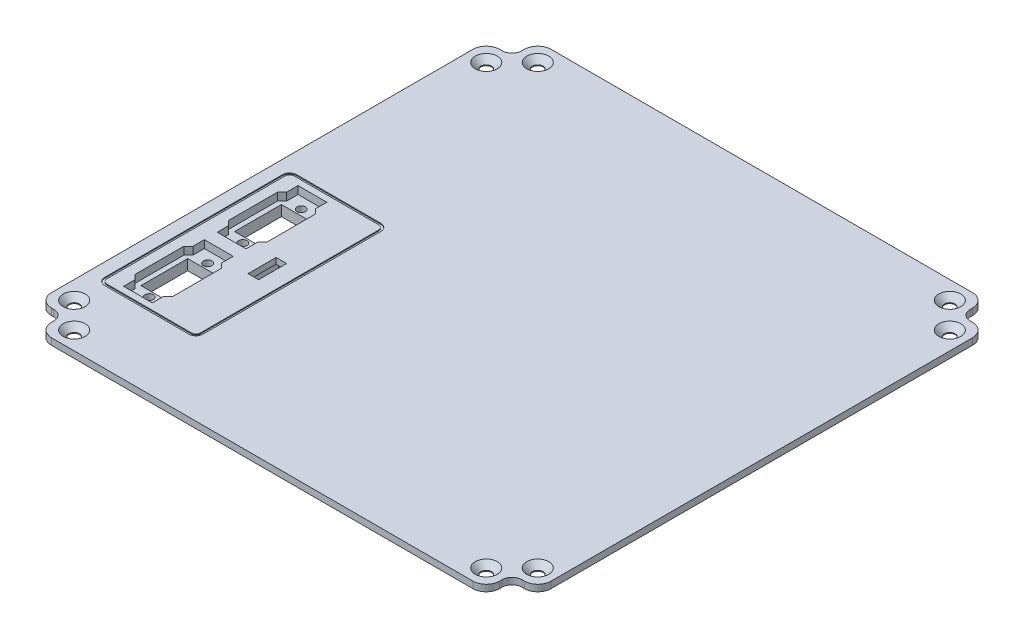
from build123d import *
from OCP.BRepFilletAPI import BRepFilletAPI_MakeChamfer, BRepFilletAPI_MakeFillet

# Parameters (mm, degrees)
SKETCH1_W                     = 214
SKETCH1_H                     = 214
BOSS_EXTRUDE1_DEPTH           = 2.8
SKETCH2_W                     = 11
SKETCH2_H                     = 11
CUT_EXTRUDE1_DEPTH            = 152.346754177
FILLET1_R1                    = 6
FILLET1_R2                    = 4
CIRPATTERN1_COUNT             = 4
FILLET1_OF_CIRPATTERN1_R1     = 6
FILLET1_OF_CIRPATTERN1_R2     = 4
FILLET1_OF_CIRPATTERN1_R3     = 6
FILLET1_OF_CIRPATTERN1_R4     = 4
FILLET1_OF_CIRPATTERN1_R5     = 6
FILLET1_OF_CIRPATTERN1_R6     = 4
CUT_EXTRUDE2_DEPTH            = 152.346754177
SKETCH7_R                     = 4.7
BOSS_EXTRUDE2_DEPTH           = 2.8
SKETCH8_W                     = 64.2
SKETCH8_H                     = 64.2
BOSS_EXTRUDE4_DEPTH           = 5
CHAMFER1_SIZE                 = 5
CHAMFER1_SIZE2                = 35
BOSS_EXTRUDE5_REACH           = 152.979
SKETCH10_W                    = 35
SKETCH10_H                    = 10.8
SKETCH10_H_2                  = 74.2
SKETCH10_H_3                  = 5
SKETCH9_W                     = 12
SKETCH9_H                     = 20
CUT_EXTRUDE3_DEPTH            = 3.3
SKETCH16_W                    = 12
SKETCH16_H                    = 20
CUT_EXTRUDE6_DEPTH            = 152.098047638
M3_CLEARANCE_HOLE1_AT_2_COUNT = 2
M3_CLEARANCE_HOLE1_AT_2_PITCH = 25
CUT_EXTRUDE_THIN1_DEPTH       = 0.4
LPATTERN1_COUNT               = 2
LPATTERN1_PITCH               = 40
SKETCH11_W                    = 4
SKETCH11_H                    = 143.4
SKETCH11_W_2                  = 143.4
SKETCH11_H_2                  = 4
SKETCH11_H_3                  = 10
CUT_EXTRUDE4_DEPTH            = 151.979402569
SKETCH12_W                    = 10.2
SKETCH12_H                    = 90
CUT_EXTRUDE5_DEPTH            = 151.979402569
SKETCH19_W                    = 8
SKETCH19_H                    = 64.2
BOSS_EXTRUDE6_DEPTH           = 5
SKETCH18_W                    = 4.5
SKETCH18_H                    = 12
CUT_EXTRUDE8_DEPTH            = 152.098047638
SKETCH21_W                    = 17.05
SKETCH21_H                    = 20
CUT_EXTRUDE10_DEPTH           = 5.3
SKETCH24_W                    = 17.05
SKETCH24_H                    = 20
SKETCH24_W_2                  = 7.3
SKETCH24_H_2                  = 16.9
BOSS_EXTRUDE7_DEPTH           = 7


# Read off the part's stored shape, not the designer's step: CSK for M4 Flat Head Machine Screw1
with BuildPart() as part:
    # Sketch1 → Boss-Extrude1 (new body)
    with BuildSketch(Plane(origin=(0, 0, 0), x_dir=(1, 0, 0), z_dir=(0, 1, 0))):
        Rectangle(SKETCH1_W, SKETCH1_H)
    extrude(amount=BOSS_EXTRUDE1_DEPTH)

    # Sketch2 → Cut-Extrude1 (cut, through all)
    with BuildSketch(Plane(origin=(0, 2.8, 0), x_dir=(1, 0, 0), z_dir=(0, 1, 0))):
        with Locations((-101.5, -101.5)):
            Rectangle(SKETCH2_W, SKETCH2_H)
    cut_extrude1 = extrude(amount=-CUT_EXTRUDE1_DEPTH, mode=Mode.SUBTRACT)

    # Fillet1: one fillet with a radius per group of edges: ONE call of the kernel's fillet builder (fillet() takes one radius for all edges)
    fillet1_edges_1 = [part.edges().sort_by_distance(p)[0] for p in [
        (-107, 1.4, 96),
        (-96, 1.4, 107),
    ]]
    fillet1_edges_2 = [part.edges().sort_by_distance(p)[0] for p in [
        (-96, 1.4, 96),
    ]]
    fillet1 = BRepFilletAPI_MakeFillet(part.part.solid().wrapped)
    for e in fillet1_edges_1:
        fillet1.Add(FILLET1_R1, e.wrapped)
    for e in fillet1_edges_2:
        fillet1.Add(FILLET1_R2, e.wrapped)
    add(Compound.cast(fillet1.Shape()), mode=Mode.REPLACE)

    # CirPattern1: Cut-Extrude1 ×4 about axis
    cirpattern1_axis = Axis((0, 0, 0), (0, 1, 0))
    for i in range(1, CIRPATTERN1_COUNT):
        add(cut_extrude1.rotate(cirpattern1_axis, i * 360 / CIRPATTERN1_COUNT), mode=Mode.SUBTRACT)

    # Fillet1 of CirPattern1: one fillet with a radius per group of edges: ONE call of the kernel's fillet builder (fillet() takes one radius for all edges)
    fillet1_of_cirpattern1_edges_1 = [part.edges().sort_by_distance(p)[0] for p in [
        (96, 1.4, 107),
        (107, 1.4, 96),
    ]]
    fillet1_of_cirpattern1_edges_2 = [part.edges().sort_by_distance(p)[0] for p in [
        (96, 1.4, 96),
    ]]
    fillet1_of_cirpattern1_edges_3 = [part.edges().sort_by_distance(p)[0] for p in [
        (107, 1.4, -96),
        (96, 1.4, -107),
    ]]
    fillet1_of_cirpattern1_edges_4 = [part.edges().sort_by_distance(p)[0] for p in [
        (96, 1.4, -96),
    ]]
    fillet1_of_cirpattern1_edges_5 = [part.edges().sort_by_distance(p)[0] for p in [
        (-96, 1.4, -107),
        (-107, 1.4, -96),
    ]]
    fillet1_of_cirpattern1_edges_6 = [part.edges().sort_by_distance(p)[0] for p in [
        (-96, 1.4, -96),
    ]]
    fillet1_of_cirpattern1 = BRepFilletAPI_MakeFillet(part.part.solid().wrapped)
    for e in fillet1_of_cirpattern1_edges_1:
        fillet1_of_cirpattern1.Add(FILLET1_OF_CIRPATTERN1_R1, e.wrapped)
    for e in fillet1_of_cirpattern1_edges_2:
        fillet1_of_cirpattern1.Add(FILLET1_OF_CIRPATTERN1_R2, e.wrapped)
    for e in fillet1_of_cirpattern1_edges_3:
        fillet1_of_cirpattern1.Add(FILLET1_OF_CIRPATTERN1_R3, e.wrapped)
    for e in fillet1_of_cirpattern1_edges_4:
        fillet1_of_cirpattern1.Add(FILLET1_OF_CIRPATTERN1_R4, e.wrapped)
    for e in fillet1_of_cirpattern1_edges_5:
        fillet1_of_cirpattern1.Add(FILLET1_OF_CIRPATTERN1_R5, e.wrapped)
    for e in fillet1_of_cirpattern1_edges_6:
        fillet1_of_cirpattern1.Add(FILLET1_OF_CIRPATTERN1_R6, e.wrapped)
    add(Compound.cast(fillet1_of_cirpattern1.Shape()), mode=Mode.REPLACE)

    # Sketch3 → Cut-Extrude2 (cut, through all)
    with BuildSketch(Plane(origin=(0, 2.8, 0), x_dir=(1, 0, 0), z_dir=(0, 1, 0))):
        with BuildLine():
            Line((100, -96), (101, -96))
            ThreePointArc((101, -96), (105.242640687, -94.242640687), (107, -90))
            Line((107, -90), (107, 90))
            ThreePointArc((107, 90), (105.242640687, 94.242640687), (101, 96))
            Line((101, 96), (100, 96))
            ThreePointArc((100, 96), (97.171572875, 97.171572875), (96, 100))
            Line((96, 100), (96, 101))
            ThreePointArc((96, 101), (94.242640687, 105.242640687), (90, 107))
            Line((90, 107), (-90, 107))
            ThreePointArc((-90, 107), (-94.242640687, 105.242640687), (-96, 101))
            Line((-96, 101), (-96, 100))
            ThreePointArc((-96, 100), (-97.171572875, 97.171572875), (-100, 96))
            Line((-100, 96), (-101, 96))
            ThreePointArc((-101, 96), (-105.242640687, 94.242640687), (-107, 90))
            Line((-107, 90), (-107, -90))
            ThreePointArc((-107, -90), (-105.242640687, -94.242640687), (-101, -96))
            Line((-101, -96), (-100, -96))
            ThreePointArc((-100, -96), (-97.171572875, -97.171572875), (-96, -100))
            Line((-96, -100), (-96, -101))
            ThreePointArc((-96, -101), (-94.242640687, -105.242640687), (-90, -107))
            Line((-90, -107), (90, -107))
            ThreePointArc((90, -107), (94.242640687, -105.242640687), (96, -101))
            Line((96, -101), (96, -100))
            ThreePointArc((96, -100), (97.171572875, -97.171572875), (100, -96))
        make_face()
        with BuildLine():
            Line((100, -95.7), (101, -95.7))
            ThreePointArc((101, -95.7), (105.030508653, -94.030508653), (106.7, -90))
            Line((106.7, -90), (106.7, 90))
            ThreePointArc((106.7, 90), (105.030508653, 94.030508653), (101, 95.7))
            Line((101, 95.7), (100, 95.7))
            ThreePointArc((100, 95.7), (96.959440841, 96.959440841), (95.7, 100))
            Line((95.7, 100), (95.7, 101))
            ThreePointArc((95.7, 101), (94.030508653, 105.030508653), (90, 106.7))
            Line((90, 106.7), (-90, 106.7))
            ThreePointArc((-90, 106.7), (-94.030508653, 105.030508653), (-95.7, 101))
            Line((-95.7, 101), (-95.7, 100))
            ThreePointArc((-95.7, 100), (-96.959440841, 96.959440841), (-100, 95.7))
            Line((-100, 95.7), (-101, 95.7))
            ThreePointArc((-101, 95.7), (-105.030508653, 94.030508653), (-106.7, 90))
            Line((-106.7, 90), (-106.7, -90))
            ThreePointArc((-106.7, -90), (-105.030508653, -94.030508653), (-101, -95.7))
            Line((-101, -95.7), (-100, -95.7))
            ThreePointArc((-100, -95.7), (-96.959440841, -96.959440841), (-95.7, -100))
            Line((-95.7, -100), (-95.7, -101))
            ThreePointArc((-95.7, -101), (-94.030508653, -105.030508653), (-90, -106.7))
            Line((-90, -106.7), (90, -106.7))
            ThreePointArc((90, -106.7), (94.030508653, -105.030508653), (95.7, -101))
            Line((95.7, -101), (95.7, -100))
            ThreePointArc((95.7, -100), (96.959440841, -96.959440841), (100, -95.7))
        make_face(mode=Mode.SUBTRACT)
    extrude(amount=-CUT_EXTRUDE2_DEPTH, mode=Mode.SUBTRACT)

    # CSK for M4 Flat Head Machine Screw1 outl → CSK for M4 Flat Head Machine Screw1 (revolve, cut)
    with BuildSketch(Plane(origin=(-99, 0, 88), x_dir=(1, 0, 0), z_dir=(0, 0, 1))):
        Polygon((0, 0), (2.25, 0), (2.25, 0.35), (4.7, 2.8), (0, 2.8), align=None)
    revolve(axis=Axis((-99, 0, 88), (0, 1, 0)), mode=Mode.SUBTRACT)

    # CSK for M4 Flat Head Machine Screw1 2 ou → CSK for M4 Flat Head Machine Screw1 2 (revolve, cut)
    with BuildSketch(Plane(origin=(99, 0, -88), x_dir=(1, 0, 0), z_dir=(0, 0, 1))):
        Polygon((0, 0), (2.25, 0), (2.25, 0.35), (4.7, 2.8), (0, 2.8), align=None)
    revolve(axis=Axis((99, 0, -88), (0, 1, 0)), mode=Mode.SUBTRACT)

    # CSK for M4 Flat Head Machine Screw1 3 ou → CSK for M4 Flat Head Machine Screw1 3 (revolve, cut)
    with BuildSketch(Plane(origin=(99, 0, 88), x_dir=(1, 0, 0), z_dir=(0, 0, 1))):
        Polygon((0, 0), (2.25, 0), (2.25, 0.35), (4.7, 2.8), (0, 2.8), align=None)
    revolve(axis=Axis((99, 0, 88), (0, 1, 0)), mode=Mode.SUBTRACT)

    # CSK for M4 Flat Head Machine Screw1 4 ou → CSK for M4 Flat Head Machine Screw1 4 (revolve, cut)
    with BuildSketch(Plane(origin=(-99, 0, -88), x_dir=(1, 0, 0), z_dir=(0, 0, 1))):
        Polygon((0, 0), (2.25, 0), (2.25, 0.35), (4.7, 2.8), (0, 2.8), align=None)
    revolve(axis=Axis((-99, 0, -88), (0, 1, 0)), mode=Mode.SUBTRACT)

    # CSK for M4 Flat Head Machine Screw1 5 ou → CSK for M4 Flat Head Machine Screw1 5 (revolve, cut)
    with BuildSketch(Plane.XY):
        Polygon((0, 0), (2.25, 0), (2.25, 0.35), (4.7, 2.8), (0, 2.8), align=None)
    revolve(axis=Axis((0, 0, 0), (0, 1, 0)), mode=Mode.SUBTRACT)

    # CSK for M4 Flat Head Machine Screw1 6 ou → CSK for M4 Flat Head Machine Screw1 6 (revolve, cut)
    with BuildSketch(Plane(origin=(-88, 0, 99), x_dir=(1, 0, 0), z_dir=(0, 0, 1))):
        Polygon((0, 0), (2.25, 0), (2.25, 0.35), (4.7, 2.8), (0, 2.8), align=None)
    revolve(axis=Axis((-88, 0, 99), (0, 1, 0)), mode=Mode.SUBTRACT)

    # CSK for M4 Flat Head Machine Screw1 7 ou → CSK for M4 Flat Head Machine Screw1 7 (revolve, cut)
    with BuildSketch(Plane(origin=(88, 0, -99), x_dir=(1, 0, 0), z_dir=(0, 0, 1))):
        Polygon((0, 0), (2.25, 0), (2.25, 0.35), (4.7, 2.8), (0, 2.8), align=None)
    revolve(axis=Axis((88, 0, -99), (0, 1, 0)), mode=Mode.SUBTRACT)

    # CSK for M4 Flat Head Machine Screw1 8 ou → CSK for M4 Flat Head Machine Screw1 8 (revolve, cut)
    with BuildSketch(Plane(origin=(88, 0, 99), x_dir=(1, 0, 0), z_dir=(0, 0, 1))):
        Polygon((0, 0), (2.25, 0), (2.25, 0.35), (4.7, 2.8), (0, 2.8), align=None)
    revolve(axis=Axis((88, 0, 99), (0, 1, 0)), mode=Mode.SUBTRACT)

    # CSK for M4 Flat Head Machine Screw1 9 ou → CSK for M4 Flat Head Machine Screw1 9 (revolve, cut)
    with BuildSketch(Plane(origin=(-88, 0, -99), x_dir=(1, 0, 0), z_dir=(0, 0, 1))):
        Polygon((0, 0), (2.25, 0), (2.25, 0.35), (4.7, 2.8), (0, 2.8), align=None)
    revolve(axis=Axis((-88, 0, -99), (0, 1, 0)), mode=Mode.SUBTRACT)

    # Sketch7 → Boss-Extrude2 (add, through all)
    with BuildSketch(Plane(origin=(0, 2.8, 0), x_dir=(1, 0, 0), z_dir=(0, 1, 0))):
        Circle(SKETCH7_R)
    extrude(amount=-BOSS_EXTRUDE2_DEPTH)

    # Sketch8 → Boss-Extrude4 (add)
    with BuildSketch(Plane.XZ):
        Polygon((-2.5, 71.7), (-66.7, 71.7), (-66.7, 106.7), (-71.7, 106.7), (-71.7, 71.7), (-106.7, 71.7), (-106.7, 66.7), (-71.7, 66.7), (-71.7, 2.5), (-106.7, 2.5), (-106.7, -2.5), (-71.7, -2.5), (-71.7, -66.7), (-106.7, -66.7), (-106.7, -71.7), (-71.7, -71.7), (-71.7, -106.7), (-66.7, -106.7), (-66.7, -71.7), (-2.5, -71.7), (-2.5, -106.7), (2.5, -106.7), (2.5, -71.7), (66.7, -71.7), (66.7, -106.7), (71.7, -106.7), (71.7, -71.7), (106.7, -71.7), (106.7, -66.7), (71.7, -66.7), (71.7, -2.5), (106.7, -2.5), (106.7, 2.5), (71.7, 2.5), (71.7, 66.7), (106.7, 66.7), (106.7, 71.7), (71.7, 71.7), (71.7, 106.7), (66.7, 106.7), (66.7, 71.7), (2.5, 71.7), (2.5, 106.7), (-2.5, 106.7), align=None)
        with Locations((-34.6, -34.6)):
            Rectangle(SKETCH8_W, SKETCH8_H, mode=Mode.SUBTRACT)
        with Locations((34.6, -34.6)):
            Rectangle(SKETCH8_W, SKETCH8_H, mode=Mode.SUBTRACT)
        with Locations((-34.6, 34.6)):
            Rectangle(SKETCH8_W, SKETCH8_H, mode=Mode.SUBTRACT)
        with Locations((34.6, 34.6)):
            Rectangle(SKETCH8_W, SKETCH8_H, mode=Mode.SUBTRACT)
    extrude(amount=BOSS_EXTRUDE4_DEPTH)

    # Chamfer1: one chamfer whose edges measure the first distance from different faces: ONE call of the kernel's chamfer builder (chamfer() names one face for all edges)
    chamfer1_edges_1 = [part.edges().sort_by_distance(p)[0] for p in [
        (69.2, -5, -106.7),
        (0, -5, -106.7),
        (-69.2, -5, -106.7),
    ]]
    chamfer1_side_1 = [part.faces().sort_by_distance(p)[0] for p in [
        (0, 0.894818653, -106.7),
    ]]
    chamfer1_edges_2 = [part.edges().sort_by_distance(p)[0] for p in [
        (69.2, -5, 106.7),
        (0, -5, 106.7),
        (-69.2, -5, 106.7),
    ]]
    chamfer1_side_2 = [part.faces().sort_by_distance(p)[0] for p in [
        (0, 0.894818653, 106.7),
    ]]
    chamfer1_edges_3 = [part.edges().sort_by_distance(p)[0] for p in [
        (-106.7, -5, 0),
        (-106.7, -5, 69.2),
        (-106.7, -5, -69.2),
    ]]
    chamfer1_side_3 = [part.faces().sort_by_distance(p)[0] for p in [
        (-106.7, 0.894818653, 0),
    ]]
    chamfer1_edges_4 = [part.edges().sort_by_distance(p)[0] for p in [
        (106.7, -5, 0),
        (106.7, -5, 69.2),
        (106.7, -5, -69.2),
    ]]
    chamfer1_side_4 = [part.faces().sort_by_distance(p)[0] for p in [
        (106.7, 0.894818653, 0),
    ]]
    chamfer1 = BRepFilletAPI_MakeChamfer(part.part.solid().wrapped)
    for e in chamfer1_edges_1:
        chamfer1.Add(CHAMFER1_SIZE, CHAMFER1_SIZE2, e.wrapped, chamfer1_side_1[0].wrapped)  # the first distance lies on this face
    for e in chamfer1_edges_2:
        chamfer1.Add(CHAMFER1_SIZE, CHAMFER1_SIZE2, e.wrapped, chamfer1_side_2[0].wrapped)  # the first distance lies on this face
    for e in chamfer1_edges_3:
        chamfer1.Add(CHAMFER1_SIZE, CHAMFER1_SIZE2, e.wrapped, chamfer1_side_3[0].wrapped)  # the first distance lies on this face
    for e in chamfer1_edges_4:
        chamfer1.Add(CHAMFER1_SIZE, CHAMFER1_SIZE2, e.wrapped, chamfer1_side_4[0].wrapped)  # the first distance lies on this face
    add(Compound.cast(chamfer1.Shape()), mode=Mode.REPLACE)

    # Boss-Extrude5: up to this face of the body (flat: up to its plane)
    boss_extrude5_end = Plane(part.part.faces().sort_by_distance((0, -5, 0))[0])
    # Sketch10 → Boss-Extrude5 (add, up to the picked face)
    with BuildSketch(Plane.XZ, mode=Mode.PRIVATE) as boss_extrude5_sk1:
        with Locations((-89.2, 7.9)):
            Rectangle(SKETCH10_W, SKETCH10_H)
    boss_extrude5_tool1 = split(extrude(boss_extrude5_sk1.sketch, amount=BOSS_EXTRUDE5_REACH, mode=Mode.PRIVATE), bisect_by=boss_extrude5_end, keep=Keep.BOTH, mode=Mode.PRIVATE)
    # Sketch10 → Boss-Extrude5 (add, up to the picked face)
    with BuildSketch(Plane.XZ, mode=Mode.PRIVATE) as boss_extrude5_sk2:
        with Locations((-89.2, -34.6)):
            Rectangle(SKETCH10_W, SKETCH10_H_2)
    boss_extrude5_tool2 = split(extrude(boss_extrude5_sk2.sketch, amount=BOSS_EXTRUDE5_REACH, mode=Mode.PRIVATE), bisect_by=boss_extrude5_end, keep=Keep.BOTH, mode=Mode.PRIVATE)
    # Sketch10 → Boss-Extrude5 (add, up to the picked face)
    with BuildSketch(Plane.XZ, mode=Mode.PRIVATE) as boss_extrude5_sk3:
        with Locations((-89.2, -74.2)):
            Rectangle(SKETCH10_W, SKETCH10_H_3)
    boss_extrude5_tool3 = split(extrude(boss_extrude5_sk3.sketch, amount=BOSS_EXTRUDE5_REACH, mode=Mode.PRIVATE), bisect_by=boss_extrude5_end, keep=Keep.BOTH, mode=Mode.PRIVATE)
    add(boss_extrude5_tool1.solids().sort_by(Axis((-89.2, 0, 7.9), (0, -1, 0)))[0])
    add(boss_extrude5_tool2.solids().sort_by(Axis((-89.2, 0, -34.6), (0, -1, 0)))[0])
    add(boss_extrude5_tool3.solids().sort_by(Axis((-89.2, 0, -74.2), (0, -1, 0)))[0])

    # Sketch9 → Cut-Extrude3 (cut)
    with BuildSketch(Plane(origin=(0, 2.8, 0), x_dir=(1, 0, 0), z_dir=(0, 1, 0))):
        Polygon((-79.4, 44.6), (-79.4, 65.4), (-81.35, 67.35), (-81.35, 72.25), (-93.65, 72.25), (-93.65, 67.35), (-95.6, 65.4), (-95.6, 44.6), (-93.65, 42.65), (-93.65, 37.75), (-81.35, 37.75), (-81.35, 42.65), align=None)
        with Locations((-87.5, 55)):
            Rectangle(SKETCH9_W, SKETCH9_H, mode=Mode.SUBTRACT)
    cut_extrude3 = extrude(amount=-CUT_EXTRUDE3_DEPTH, mode=Mode.SUBTRACT)

    # Sketch16 → Cut-Extrude6 (cut, through all)
    with BuildSketch(Plane(origin=(0, 2.8, 0), x_dir=(1, 0, 0), z_dir=(0, 1, 0))):
        with Locations((-87.5, 55)):
            Rectangle(SKETCH16_W, SKETCH16_H)
    cut_extrude6 = extrude(amount=-CUT_EXTRUDE6_DEPTH, mode=Mode.SUBTRACT)

    # Sketch15 → M3 Clearance Hole1 (revolve, cut)
    with BuildSketch(Plane(origin=(-87.5, -0.5, -67.5), x_dir=(0, 0, 1), z_dir=(1, 0, 0))):
        Polygon((0, 0), (0, 7.081549114), (1.8, 6), (1.8, 0), align=None)
    m3_clearance_hole1 = revolve(axis=Axis((-87.5, 5.85, -67.5), (0, -1, 0)), mode=Mode.SUBTRACT)

    # M3 Clearance Hole1 at 2: M3 Clearance Hole1 ×2
    with Locations(*[(0, 0, i * M3_CLEARANCE_HOLE1_AT_2_PITCH) for i in range(1, M3_CLEARANCE_HOLE1_AT_2_COUNT)]):
        add(m3_clearance_hole1, mode=Mode.SUBTRACT)

    # Sketch9<3> → Cut-Extrude-Thin1 (cut)
    with BuildSketch(Plane(origin=(0, 2.8, 0), x_dir=(1, 0, 0), z_dir=(0, 1, 0))):
        with BuildLine():
            Line((-59, 73), (-59, -3))
            ThreePointArc((-59, -3), (-59.878679656, -5.121320344), (-62, -6))
            Line((-62, -6), (-98, -6))
            ThreePointArc((-98, -6), (-100.121320344, -5.121320344), (-101, -3))
            Line((-101, -3), (-101, 73))
            ThreePointArc((-101, 73), (-100.121320344, 75.121320344), (-98, 76))
            Line((-98, 76), (-62, 76))
            ThreePointArc((-62, 76), (-59.878679656, 75.121320344), (-59, 73))
        make_face()
        with BuildLine():
            Line((-60, 73), (-60, -3))
            ThreePointArc((-60, -3), (-60.585786438, -4.414213562), (-62, -5))
            Line((-62, -5), (-98, -5))
            ThreePointArc((-98, -5), (-99.414213562, -4.414213562), (-100, -3))
            Line((-100, -3), (-100, 73))
            ThreePointArc((-100, 73), (-99.414213562, 74.414213562), (-98, 75))
            Line((-98, 75), (-62, 75))
            ThreePointArc((-62, 75), (-60.585786438, 74.414213562), (-60, 73))
        make_face(mode=Mode.SUBTRACT)
    extrude(amount=-CUT_EXTRUDE_THIN1_DEPTH, mode=Mode.SUBTRACT)

    # LPattern1: Cut-Extrude3, Cut-Extrude6, M3 Clearance Hole1 ×2
    with Locations(*[(0, 0, i * LPATTERN1_PITCH) for i in range(1, LPATTERN1_COUNT)]):
        add(cut_extrude3, mode=Mode.SUBTRACT)
        add(cut_extrude6, mode=Mode.SUBTRACT)
        add(m3_clearance_hole1, mode=Mode.SUBTRACT)

    # LPattern1 copy 1 sketch → LPattern1 copy 1 (revolve, cut)
    with BuildSketch(Plane(origin=(-87.5, -0.5, -2.5), x_dir=(0, 0, 1), z_dir=(1, 0, 0))):
        Polygon((0, 0), (0, 7.081549114), (1.8, 6), (1.8, 0), align=None)
    revolve(axis=Axis((-87.5, 5.85, -2.5), (0, -1, 0)), mode=Mode.SUBTRACT)

    # Sketch11 → Cut-Extrude4 (cut, through all)
    with BuildSketch(Plane.XZ):
        with Locations((104.7, 0)):
            Rectangle(SKETCH11_W, SKETCH11_H)
        with Locations((0, -104.7)):
            Rectangle(SKETCH11_W_2, SKETCH11_H_2)
        with Locations((0, 104.7)):
            Rectangle(SKETCH11_W_2, SKETCH11_H_2)
        with Locations((-104.7, 66.7)):
            Rectangle(SKETCH11_W, SKETCH11_H_3)
    extrude(amount=CUT_EXTRUDE4_DEPTH, mode=Mode.SUBTRACT)

    # Sketch12 → Cut-Extrude5 (cut, through all)
    with BuildSketch(Plane.XZ):
        with Locations((-101.6, -31.7)):
            Rectangle(SKETCH12_W, SKETCH12_H)
    extrude(amount=CUT_EXTRUDE5_DEPTH, mode=Mode.SUBTRACT)

    # Sketch19 → Boss-Extrude6 (add)
    with BuildSketch(Plane.XZ):
        with Locations((-62.7, -34.6)):
            Rectangle(SKETCH19_W, SKETCH19_H)
    extrude(amount=BOSS_EXTRUDE6_DEPTH)

    # Sketch18 → Cut-Extrude8 (cut, through all)
    with BuildSketch(Plane(origin=(0, 2.8, 0), x_dir=(1, 0, 0), z_dir=(0, 1, 0))):
        with Locations((-69.5, 35)):
            Rectangle(SKETCH18_W, SKETCH18_H)
    extrude(amount=-CUT_EXTRUDE8_DEPTH, mode=Mode.SUBTRACT)

    # Sketch21 → Cut-Extrude10 (cut)
    with BuildSketch(Plane.XZ.offset(5)):
        with Locations((-67.225, -35)):
            Rectangle(SKETCH21_W, SKETCH21_H)
    extrude(amount=-CUT_EXTRUDE10_DEPTH, mode=Mode.SUBTRACT)

    # Sketch24 → Boss-Extrude7 (add)
    with BuildSketch(Plane.XZ.offset(-0.3)):
        with Locations((-67.225, -35)):
            Rectangle(SKETCH24_W, SKETCH24_H)
        with Locations((-69.5, -35)):
            Rectangle(SKETCH24_W_2, SKETCH24_H_2, mode=Mode.SUBTRACT)
    extrude(amount=BOSS_EXTRUDE7_DEPTH)


with BuildPart() as body_2:
    # Mirror2: mirrored copy
    add(part.part.mirror(Plane.XY))


solid = body_2.part
